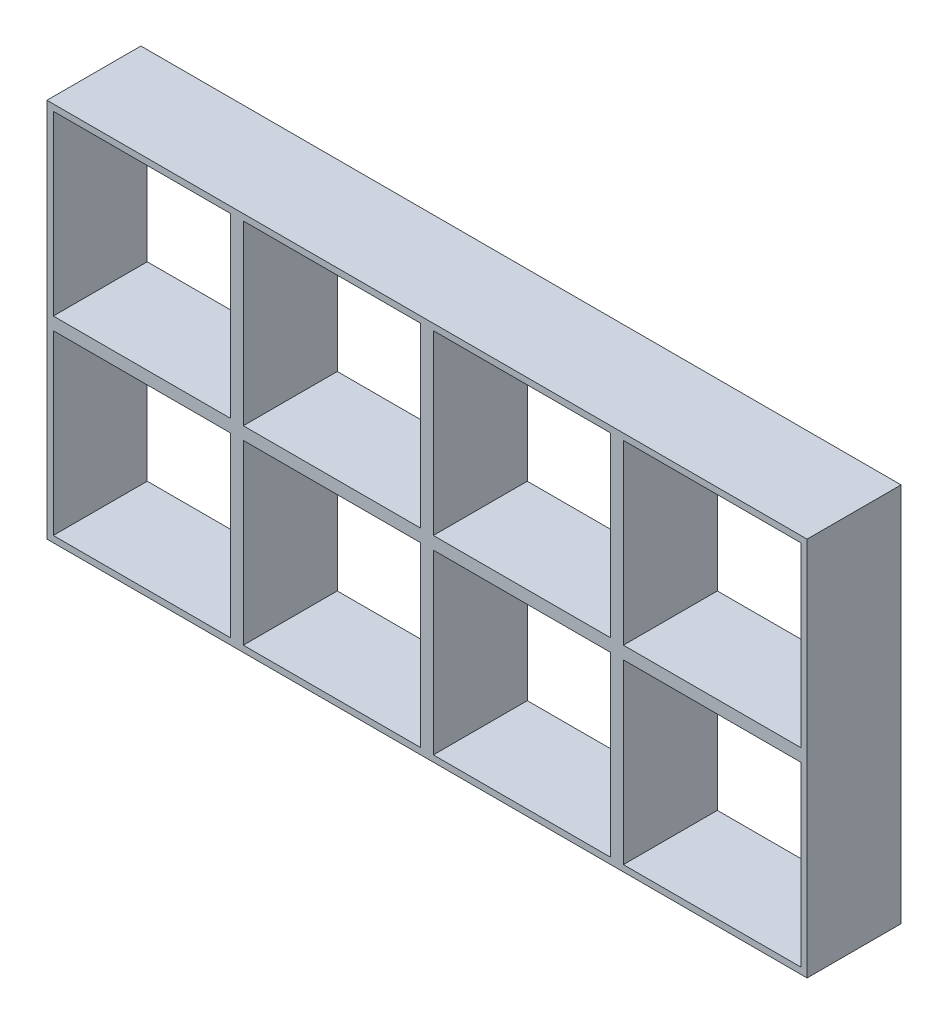
from build123d import *

# Parameters (mm, degrees)
ESQUISSE1_W        = 120
ESQUISSE1_H        = 30
ESQUISSE1_W_2      = 28
ESQUISSE1_H_2      = 28
BOSS_EXTRU_1_DEPTH = 14.833333343


with BuildPart() as part:
    # Esquisse1 → Boss.-Extru.1 (new body)
    with BuildSketch(Plane.XY):
        with Locations((60, 15)):
            Rectangle(ESQUISSE1_W, ESQUISSE1_H)
        with Locations((15, 15)):
            Rectangle(ESQUISSE1_W_2, ESQUISSE1_H_2, mode=Mode.SUBTRACT)
        with Locations((45, 15)):
            Rectangle(ESQUISSE1_W_2, ESQUISSE1_H_2, mode=Mode.SUBTRACT)
        with Locations((75, 15)):
            Rectangle(ESQUISSE1_W_2, ESQUISSE1_H_2, mode=Mode.SUBTRACT)
        with Locations((105, 15)):
            Rectangle(ESQUISSE1_W_2, ESQUISSE1_H_2, mode=Mode.SUBTRACT)
    boss_extru_1 = extrude(amount=BOSS_EXTRU_1_DEPTH)

    # Symétrie1: Boss.-Extru.1 across plane
    add(boss_extru_1.mirror(Plane(origin=(0, 0, 14.833333343), x_dir=(0, 0, 1), z_dir=(0, 1, 0))))


solid = part.part
